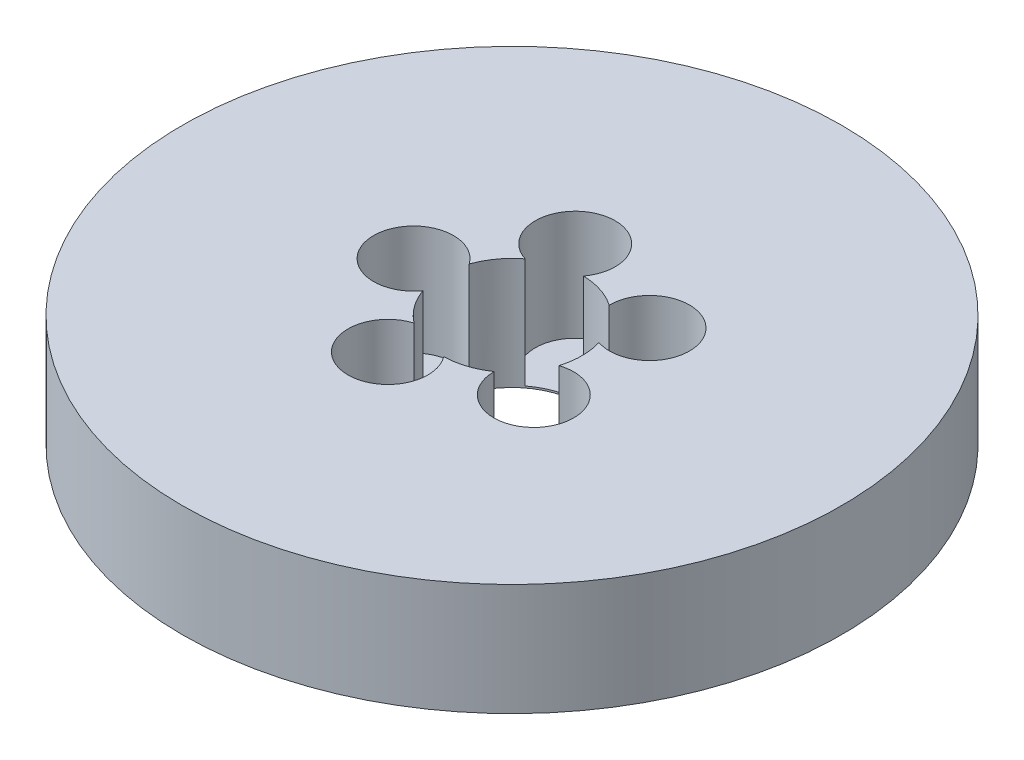
from build123d import *

# Parameters (mm, degrees)
SKETCH1_R           = 82.5
BOSS_EXTRUDE1_DEPTH = 28
SKETCH2_R           = 17.5
CUT_EXTRUDE1_DEPTH  = 120.98541578
SKETCH3_R           = 10
CUT_EXTRUDE2_DEPTH  = 27.547736455
CIRPATTERN1_COUNT   = 5


with BuildPart() as part:
    # Sketch1 → Boss-Extrude1 (new body)
    with BuildSketch(Plane(origin=(0, 0, 0), x_dir=(1, 0, 0), z_dir=(0, 1, 0))):
        Circle(SKETCH1_R)
    extrude(amount=BOSS_EXTRUDE1_DEPTH)

    # Sketch2 → Cut-Extrude1 (cut, through all)
    with BuildSketch(Plane(origin=(0, 0, 0), x_dir=(1, 0, 0), z_dir=(0, 1, 0))):
        Circle(SKETCH2_R)
    extrude(amount=CUT_EXTRUDE1_DEPTH, mode=Mode.SUBTRACT)

    # Sketch3 → Cut-Extrude2 (cut)
    with BuildSketch(Plane(origin=(0, 28, 0), x_dir=(1, 0, 0), z_dir=(0, 1, 0))):
        with Locations((-24.651295588, 0)):
            Circle(SKETCH3_R)
    cut_extrude2 = extrude(amount=-CUT_EXTRUDE2_DEPTH, mode=Mode.SUBTRACT)

    # CirPattern1: Cut-Extrude2 ×5 about axis
    cirpattern1_axis = Axis((0, 0, 0), (0, 1, 0))
    for i in range(1, CIRPATTERN1_COUNT):
        add(cut_extrude2.rotate(cirpattern1_axis, i * 360 / CIRPATTERN1_COUNT), mode=Mode.SUBTRACT)


solid = part.part
